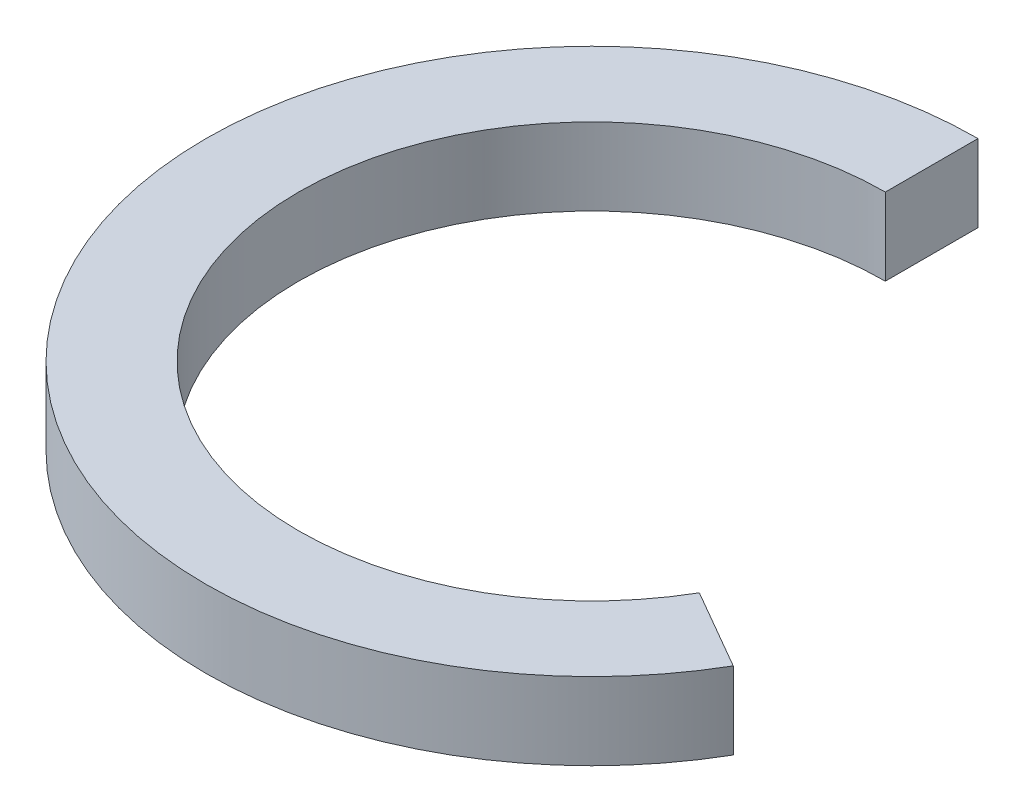
from build123d import *

# Parameters (mm, degrees)
BOSS_EXTRUDE1_DEPTH               = 3.175
BOSS_EXTRUDE2_START               = -12.7
BOSS_EXTRUDE2_DEPTH               = 12.7
PIPE_TAP_DRILL_FOR_1_4_TAP1_D     = 11.1252
PIPE_TAP_DRILL_FOR_1_4_TAP1_DEPTH = 15.875
PIPE_TAP_DRILL_FOR_1_4_TAP1_TIP   = 3.342347279


with BuildPart() as part:
    # Sketch1 → Boss-Extrude1 (new body)
    with BuildSketch(Plane(origin=(0, 0, 0), x_dir=(1, 0, 0), z_dir=(0, 1, 0))):
        with BuildLine():
            ThreePointArc((52.242982483, -30.1625), (-52.242982483, -30.1625), (0, 60.325))
            Line((0, 60.325), (0, 79.375))
            ThreePointArc((0, 79.375), (-68.740766425, -39.6875), (68.740766425, -39.6875))
            Line((68.740766425, -39.6875), (52.242982483, -30.1625))
        make_face()
    extrude(amount=BOSS_EXTRUDE1_DEPTH)

    # Sketch1<3> → Boss-Extrude2 (add)
    with BuildSketch(Plane(origin=(0, 0, 0), x_dir=(1, 0, 0), z_dir=(0, 1, 0)).offset(BOSS_EXTRUDE2_START)):
        with BuildLine():
            ThreePointArc((52.242982483, -30.1625), (-52.242982483, -30.1625), (0, 60.325))
            Line((0, 60.325), (0, 79.375))
            ThreePointArc((0, 79.375), (-68.740766425, -39.6875), (68.740766425, -39.6875))
            Line((68.740766425, -39.6875), (52.242982483, -30.1625))
        make_face()
        with BuildLine():
            Line((-3.175, 72.748389157), (-3.175, 66.371930249))
            ThreePointArc((-3.175, 66.371930249), (-4.000459138, 64.236448398), (-6.047619048, 63.211362142))
            ThreePointArc((-6.047619048, 63.211362142), (-57.148306355, -27.682504958), (45.85160143, -43.930406854))
            ThreePointArc((45.85160143, -43.930406854), (47.696110936, -42.983703092), (49.731681501, -43.377296539))
            Line((49.731681501, -43.377296539), (55.379055152, -46.637809237))
            ThreePointArc((55.379055152, -46.637809237), (56.92983801, -48.905977846), (56.13031842, -51.534719889))
            ThreePointArc((56.13031842, -51.534719889), (-68.361489295, -33.662245638), (-6.626086957, 75.911362599))
            ThreePointArc((-6.626086957, 75.911362599), (-4.204767039, 75.089030211), (-3.175, 72.748389157))
        make_face(mode=Mode.SUBTRACT)
    extrude(amount=BOSS_EXTRUDE2_DEPTH)

    # Pipe Tap Drill for 1/4 Tap1
    with Locations(Plane(origin=(60.491874454, -6.35, 34.925), x_dir=(-0.866025403784, 0, -0.5), z_dir=(0.5, 0, -0.866025403784))):
        with Locations((0, 0)):
            Hole(PIPE_TAP_DRILL_FOR_1_4_TAP1_D / 2, depth=PIPE_TAP_DRILL_FOR_1_4_TAP1_DEPTH)
            with Locations((0, 0, -(PIPE_TAP_DRILL_FOR_1_4_TAP1_DEPTH + PIPE_TAP_DRILL_FOR_1_4_TAP1_TIP / 2))):  # 118° drill point
                Cone(0, PIPE_TAP_DRILL_FOR_1_4_TAP1_D / 2, PIPE_TAP_DRILL_FOR_1_4_TAP1_TIP, mode=Mode.SUBTRACT)


solid = part.part
